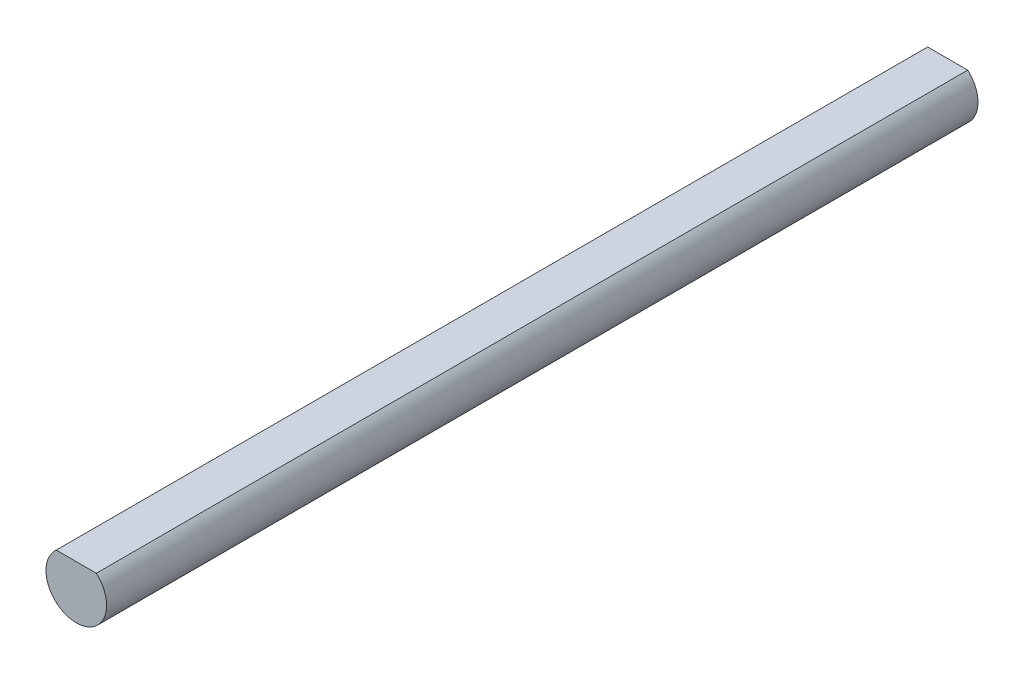
from build123d import *

# Parameters (mm, degrees)
SKETCH1_R           = 4
BOSS_EXTRUDE1_DEPTH = 115
CUT_EXTRUDE1_REACH  = 117.139


with BuildPart() as part:
    # Sketch1 → Boss-Extrude1 (new body)
    with BuildSketch(Plane.XY):
        Circle(SKETCH1_R)
    extrude(amount=BOSS_EXTRUDE1_DEPTH)

    # Sketch2 → Cut-Extrude1 (cut, up to next)
    with BuildSketch(Plane.XY.offset(115), mode=Mode.PRIVATE) as cut_extrude1_sk1:
        with BuildLine():
            Line((-2.645751311, 3), (2.645751311, 3))
            ThreePointArc((2.645751311, 3), (0, 4), (-2.645751311, 3))
        make_face()
    cut_extrude1_tool1 = extrude(cut_extrude1_sk1.sketch, amount=-CUT_EXTRUDE1_REACH, mode=Mode.PRIVATE) & part.part
    add(cut_extrude1_tool1.solids().sort_by_distance((0, 3.404621, 115))[0], mode=Mode.SUBTRACT)


solid = part.part
